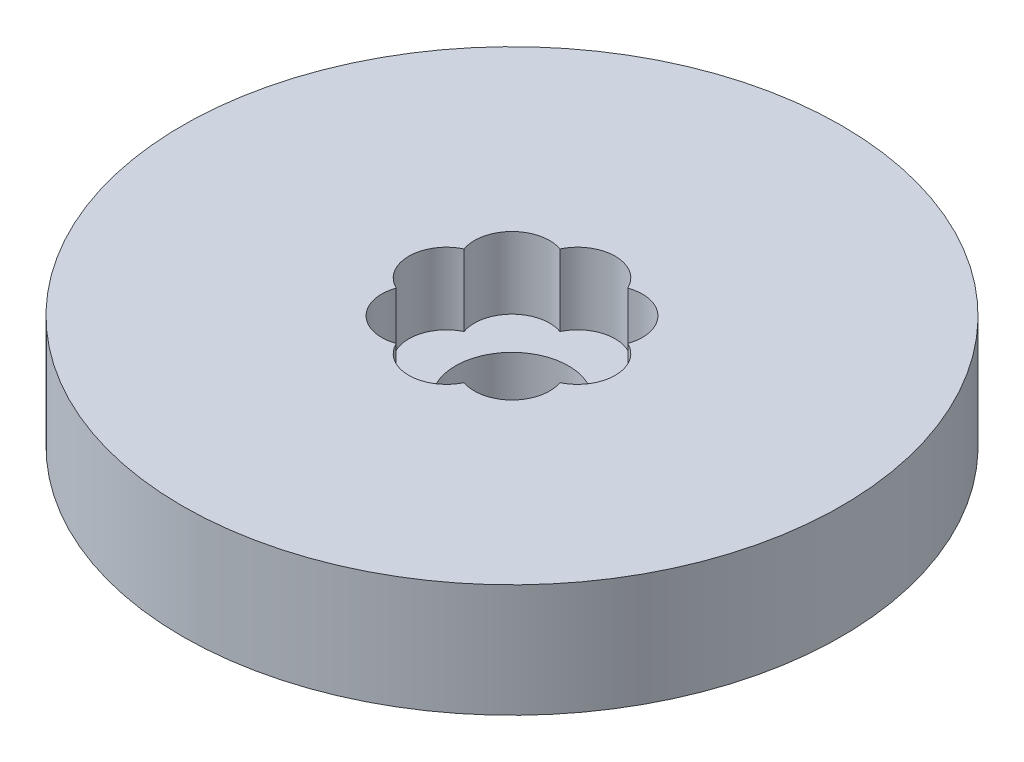
from build123d import *

# Parameters (mm, degrees)
SKETCH1_R           = 87.5
BOSS_EXTRUDE1_DEPTH = 30
SKETCH2_R           = 15
CUT_EXTRUDE1_DEPTH  = 128.328315782
SKETCH3_R           = 10
CUT_EXTRUDE2_DEPTH  = 19.004624125
CIRPATTERN1_COUNT   = 8


with BuildPart() as part:
    # Sketch1 → Boss-Extrude1 (new body)
    with BuildSketch(Plane(origin=(0, 0, 0), x_dir=(1, 0, 0), z_dir=(0, 1, 0))):
        Circle(SKETCH1_R)
    extrude(amount=BOSS_EXTRUDE1_DEPTH)

    # Sketch2 → Cut-Extrude1 (cut, through all)
    with BuildSketch(Plane(origin=(0, 0, 0), x_dir=(1, 0, 0), z_dir=(0, 1, 0))):
        Circle(SKETCH2_R)
    extrude(amount=CUT_EXTRUDE1_DEPTH, mode=Mode.SUBTRACT)

    # Sketch3 → Cut-Extrude2 (cut)
    with BuildSketch(Plane(origin=(0, 30, 0), x_dir=(1, 0, 0), z_dir=(0, 1, 0))):
        with Locations((-17.408300276, 0)):
            Circle(SKETCH3_R)
    cut_extrude2 = extrude(amount=-CUT_EXTRUDE2_DEPTH, mode=Mode.SUBTRACT)

    # CirPattern1: Cut-Extrude2 ×8 about axis
    cirpattern1_axis = Axis((0, 0, 0), (0, 1, 0))
    for i in range(1, CIRPATTERN1_COUNT):
        add(cut_extrude2.rotate(cirpattern1_axis, i * 360 / CIRPATTERN1_COUNT), mode=Mode.SUBTRACT)


solid = part.part
